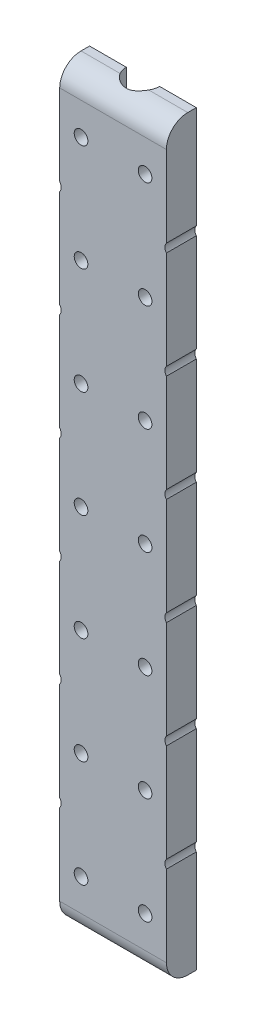
from build123d import *

# Parameters (mm, degrees)
EXTRUDE_1_DEPTH             = 87.5
SKETCH_4_R                  = 1.6
CUT_EXTRUDE_3_DEPTH         = 89.665100237
PATTERN_LINEAR_2_COUNT      = 6
PATTERN_LINEAR_2_PITCH      = 25
FILLET_1_R                  = 5
SKETCH_5_R                  = 1.6
CUT_EXTRUDE_4_DEPTH         = 89.665100357
PATTERN_LINEAR_3_COUNT      = 2
PATTERN_LINEAR_3_PITCH      = 15
PATTERN_LINEAR_3_COUNT_DIR2 = 7
PATTERN_LINEAR_3_PITCH_DIR2 = 25


with BuildPart() as part:
    # 草图2 → 凸台-拉伸1 (new, symmetric)
    with BuildSketch(Plane(origin=(0, 0, 0), x_dir=(1, 0, 0), z_dir=(0, 1, 0))):
        with BuildLine():
            Line((-3.9, 0), (-12.5, 0))
            Line((-12.5, 0), (-12.5, -7))
            Line((-12.5, -7), (12.5, -7))
            Line((12.5, -7), (12.5, 0))
            Line((12.5, 0), (3.9, 0))
            ThreePointArc((3.9, 0), (0, -3.9), (-3.9, 0))
        make_face()
    extrude(amount=EXTRUDE_1_DEPTH, both=True)

    # 草图4 → 切除-拉伸3 (cut, through all)
    with BuildSketch(Plane.XY):
        with Locations((-13.75, 62.5)):
            Circle(SKETCH_4_R)
        with Locations((13.75, 62.5)):
            Circle(SKETCH_4_R)
    cut_extrude_3 = extrude(amount=CUT_EXTRUDE_3_DEPTH, mode=Mode.SUBTRACT)

    # 阵列(线性)2: 切除-拉伸3 ×6
    with Locations(*[(0, -i * PATTERN_LINEAR_2_PITCH, 0) for i in range(1, PATTERN_LINEAR_2_COUNT)]):
        add(cut_extrude_3, mode=Mode.SUBTRACT)

    # 圆角1
    # the kernel refuses this fillet: 5 mm, written as the material it takes off along each edge
    with BuildSketch(Plane(origin=(-25, 87.5, 7), x_dir=(0, -1, 0), z_dir=(1, 0, 0))) as fillet_1_piece_1:
        with BuildLine():
            CenterArc((FILLET_1_R, FILLET_1_R), FILLET_1_R, 180, 90)
            Line((0, FILLET_1_R), (0, 0))
            Line((0, 0), (FILLET_1_R, 0))
        make_face()
    extrude(amount=50, mode=Mode.SUBTRACT)
    with BuildSketch(Plane(origin=(-25, -87.5, 7), x_dir=(0, 1, 0), z_dir=(1, 0, 0))) as fillet_1_piece_2:
        with BuildLine():
            CenterArc((FILLET_1_R, -FILLET_1_R), FILLET_1_R, 90, 90)
            Line((0, -FILLET_1_R), (0, 0))
            Line((0, 0), (FILLET_1_R, 0))
        make_face()
    extrude(amount=50, mode=Mode.SUBTRACT)

    # 草图5 → 切除-拉伸4 (cut, through all)
    with BuildSketch(Plane.XY.offset(7)):
        with Locations((-7.5, 75)):
            Circle(SKETCH_5_R)
    cut_extrude_4 = extrude(amount=-CUT_EXTRUDE_4_DEPTH, mode=Mode.SUBTRACT)

    # 阵列(线性)3: Cut-Extrude 4 2 × 7
    with Locations(*[(i * PATTERN_LINEAR_3_PITCH, -j * PATTERN_LINEAR_3_PITCH_DIR2, 0) for i in range(PATTERN_LINEAR_3_COUNT) for j in range(PATTERN_LINEAR_3_COUNT_DIR2) if (i, j) != (0, 0)]):
        add(cut_extrude_4, mode=Mode.SUBTRACT)


solid = part.part
